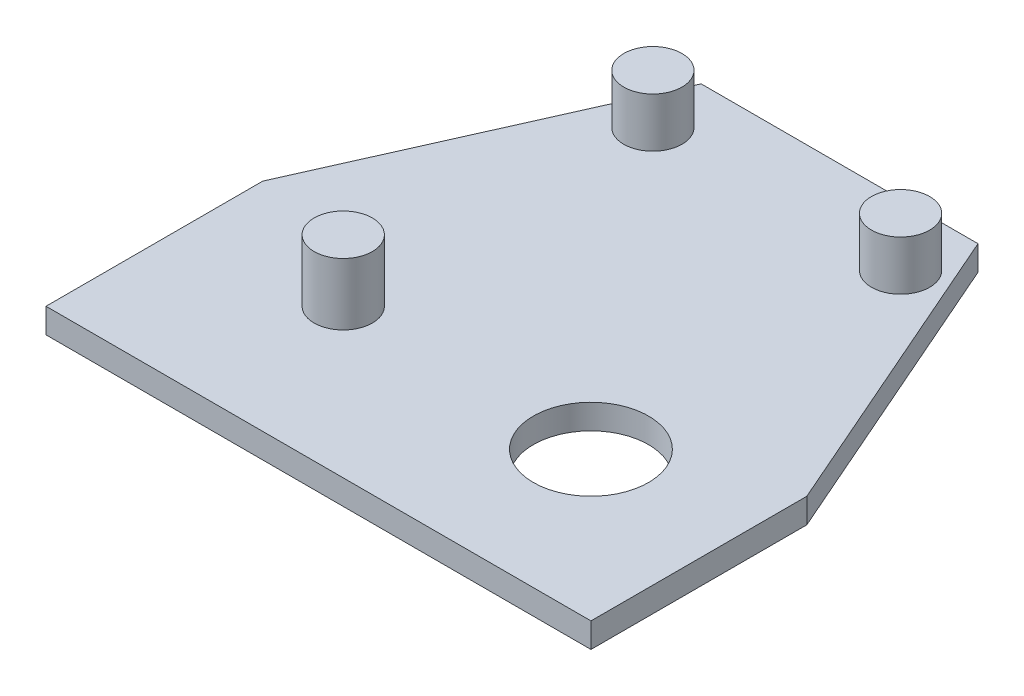
from build123d import *

# Parameters (mm, degrees)
SKETCH1_W           = 40
SKETCH1_H           = 20
BOSS_EXTRUDE1_DEPTH = 2
SKETCH5_W           = 50
SKETCH5_H           = 20
BOSS_EXTRUDE4_DEPTH = 2
SKETCH6_R           = 2.35
BOSS_EXTRUDE5_DEPTH = 4
SKETCH15_R          = 4.65
CUT_EXTRUDE6_DEPTH  = 6
SKETCH17_W          = 10
SKETCH17_H          = 20
CUT_EXTRUDE8_DEPTH  = 43.614551505
CUT_EXTRUDE9_DEPTH  = 2
SKETCH19_R          = 2.35
BOSS_EXTRUDE6_DEPTH = 5
BOSS_EXTRUDE7_DEPTH = 2


with BuildPart() as part:
    # Sketch1 → Boss-Extrude1 (new body)
    with BuildSketch(Plane(origin=(0, 0, 0), x_dir=(1, 0, 0), z_dir=(0, 1, 0))):
        Rectangle(SKETCH1_W, SKETCH1_H)
    extrude(amount=BOSS_EXTRUDE1_DEPTH)

    # Sketch5 → Boss-Extrude4 (add)
    with BuildSketch(Plane(origin=(0, 2, 0), x_dir=(1, 0, 0), z_dir=(0, 1, 0))):
        with Locations((5, 20)):
            Rectangle(SKETCH5_W, SKETCH5_H)
    extrude(amount=-BOSS_EXTRUDE4_DEPTH)

    # Sketch6 → Boss-Extrude5 (add)
    with BuildSketch(Plane(origin=(0, 2, 0), x_dir=(1, 0, 0), z_dir=(0, 1, 0))):
        with Locations((-10, 25)):
            Circle(SKETCH6_R)
        with Locations((10, 25)):
            Circle(SKETCH6_R)
    extrude(amount=BOSS_EXTRUDE5_DEPTH)

    # Sketch15 → Cut-Extrude6 (cut)
    with BuildSketch(Plane(origin=(0, 2, 0), x_dir=(1, 0, 0), z_dir=(0, 1, 0))):
        with Locations((10, 0)):
            Circle(SKETCH15_R)
    extrude(amount=-CUT_EXTRUDE6_DEPTH, mode=Mode.SUBTRACT)

    # Sketch17 → Cut-Extrude8 (cut, through all)
    with BuildSketch(Plane(origin=(0, 2, 0), x_dir=(1, 0, 0), z_dir=(0, 1, 0))):
        with Locations((25, 20)):
            Rectangle(SKETCH17_W, SKETCH17_H)
    extrude(amount=-CUT_EXTRUDE8_DEPTH, mode=Mode.SUBTRACT)

    # Sketch18 → Cut-Extrude9 (cut)
    with BuildSketch(Plane(origin=(0, 2, 0), x_dir=(1, 0, 0), z_dir=(0, 1, 0))):
        Polygon((-11.1, 30), (-20, 10), (-20, 30), align=None)
        Polygon((20, 10), (11.25, 30), (20, 30), align=None)
    extrude(amount=-CUT_EXTRUDE9_DEPTH, mode=Mode.SUBTRACT)

    # Sketch19 → Boss-Extrude6 (add)
    with BuildSketch(Plane(origin=(0, 2, 0), x_dir=(1, 0, 0), z_dir=(0, 1, 0))):
        with Locations((-10, 0)):
            Circle(SKETCH19_R)
    extrude(amount=BOSS_EXTRUDE6_DEPTH)

    # Sketch20 → Boss-Extrude7 (add)
    with BuildSketch(Plane(origin=(0, 2, 0), x_dir=(1, 0, 0), z_dir=(0, 1, 0))):
        Polygon((-20, 10), (-22, 5.505617978), (-22, -12), (-20, -12), (20, -12), (22, -12), (22, 5.428571429), (20, 10), (20, -10), (-20, -10), align=None)
    extrude(amount=-BOSS_EXTRUDE7_DEPTH)


solid = part.part
